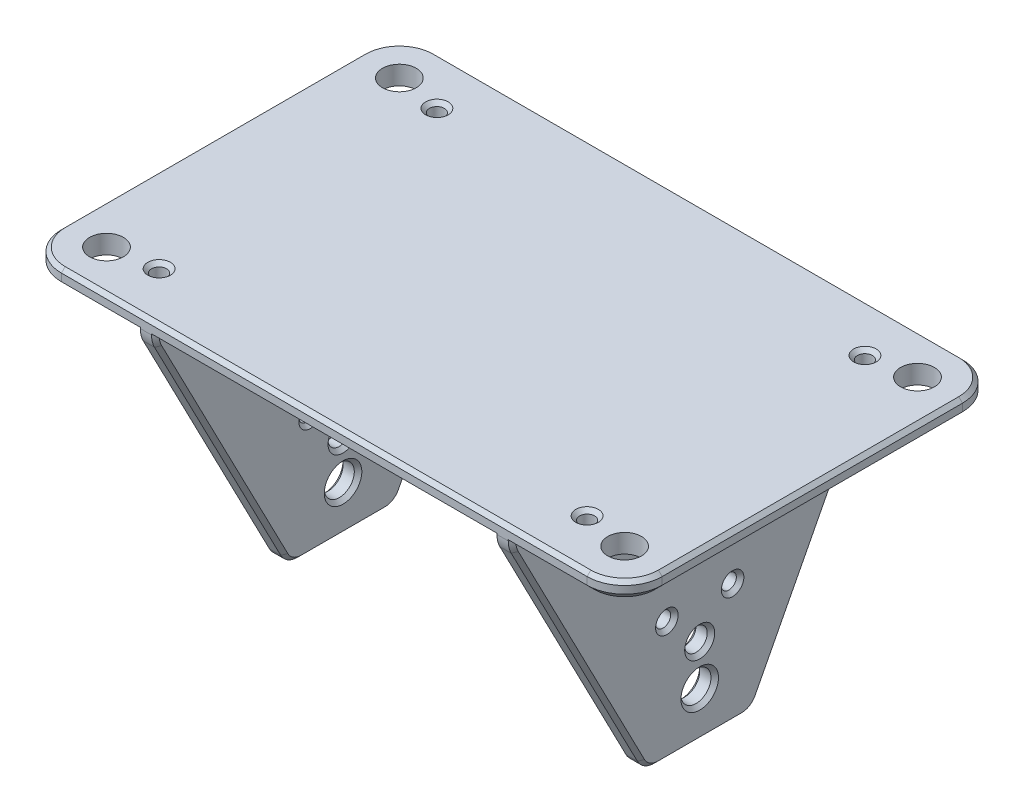
from build123d import *

# Parameters (mm, degrees)
SKETCH1_W           = 160
SKETCH1_H           = 100
BOSS_EXTRUDE1_DEPTH = 5
SKETCH2_R           = 2
CUT_EXTRUDE1_DEPTH  = 95.472218138
SKETCH3_R           = 4.5
CUT_EXTRUDE2_DEPTH  = 95.472218138
BOSS_EXTRUDE2_START = -30
BOSS_EXTRUDE2_DEPTH = 5
SKETCH6_R           = 2
SKETCH6_R_2         = 3
SKETCH6_R_3         = 4
CUT_EXTRUDE3_DEPTH  = 158.721273137
FILLET3_R           = 5
FILLET9_R           = 10
CHAMFER2_SIZE       = 2
FILLET8_R           = 7
CHAMFER3_SIZE       = 1
CHAMFER4_SIZE       = 1
CHAMFER5_SIZE       = 1


with BuildPart() as part:
    # Sketch1 → Boss-Extrude1 (new body)
    with BuildSketch(Plane(origin=(0, 0, 0), x_dir=(1, 0, 0), z_dir=(0, 1, 0))):
        Rectangle(SKETCH1_W, SKETCH1_H)
    extrude(amount=-BOSS_EXTRUDE1_DEPTH)

    # Sketch2 → Cut-Extrude1 (cut, through all)
    with BuildSketch(Plane(origin=(0, 0, 0), x_dir=(1, 0, 0), z_dir=(0, 1, 0))):
        with Locations(Location((-57, 37, 0), (0, 0, 270))):
            Circle(SKETCH2_R)
        with Locations(Location((57, 37, 0), (0, 0, 270))):
            Circle(SKETCH2_R)
        with Locations(Location((57, -37, 0), (0, 0, 270))):
            Circle(SKETCH2_R)
        with Locations(Location((-57, -37, 0), (0, 0, 270))):
            Circle(SKETCH2_R)
    extrude(amount=-CUT_EXTRUDE1_DEPTH, mode=Mode.SUBTRACT)

    # Sketch3 → Cut-Extrude2 (cut, through all)
    with BuildSketch(Plane(origin=(0, 0, 0), x_dir=(1, 0, 0), z_dir=(0, 1, 0))):
        with Locations(Location((-69, 39, 0), (0, 0, 270))):
            Circle(SKETCH3_R)
        with Locations(Location((69, 39, 0), (0, 0, 270))):
            Circle(SKETCH3_R)
        with Locations(Location((-69, -39, 0), (0, 0, 270))):
            Circle(SKETCH3_R)
        with Locations(Location((69, -39, 0), (0, 0, 270))):
            Circle(SKETCH3_R)
    extrude(amount=-CUT_EXTRUDE2_DEPTH, mode=Mode.SUBTRACT)

    # Sketch4 → Boss-Extrude2 (add)
    with BuildSketch(Plane.ZY.offset(80).offset(BOSS_EXTRUDE2_START)):
        Polygon((50, -5), (14.2, -74), (-14.2, -74), (-50, -5), align=None)
    boss_extrude2 = extrude(amount=-BOSS_EXTRUDE2_DEPTH)

    # Mirror1: Boss-Extrude2 across plane
    add(boss_extrude2.mirror(Plane.ZY))

    # Sketch6 → Cut-Extrude3 (cut, through all)
    with BuildSketch(Plane.ZY.offset(50)):
        with Locations(Location((-8.75, -42, 0), (0, 0, 180))):
            Circle(SKETCH6_R)
        with Locations(Location((0, -51, 0), (0, 0, 180))):
            Circle(SKETCH6_R_2)
        with Locations(Location((0, -61.8, 0), (0, 0, 180))):
            Circle(SKETCH6_R_3)
        with Locations(Location((8.75, -42, 0), (0, 0, 180))):
            Circle(SKETCH6_R)
    extrude(amount=-CUT_EXTRUDE3_DEPTH, mode=Mode.SUBTRACT)

    # Fillet3
    fillet3_edges = [part.edges().sort_by_distance(p)[0] for p in [
        (-47.5, -74, 14.2),
        (-47.5, -74, -14.2),
        (47.5, -74, 14.2),
        (47.5, -74, -14.2),
    ]]
    fillet(fillet3_edges, radius=FILLET3_R)

    # Fillet9
    fillet9_edges = [part.edges().sort_by_distance(p)[0] for p in [
        (80, -2.5, 50),
        (-80, -2.5, 50),
        (-80, -2.5, -50),
        (80, -2.5, -50),
    ]]
    fillet(fillet9_edges, radius=FILLET9_R)

    # Chamfer2
    # the kernel refuses this chamfer: 2 mm, written as the material it takes off along each edge
    with BuildSketch(Plane(origin=(-70, -5, 50), x_dir=(0, 0.9996219169112968, 0.02749587661058563), z_dir=(1, 0, 0)), Plane(origin=(50, -5, 50), x_dir=(0, 0.9996219169112968, 0.02749587661058563), z_dir=(1, 0, 0))) as chamfer2_piece_1:
        Polygon((CHAMFER2_SIZE * 0.999621916911, -CHAMFER2_SIZE * 0.0274958766106), (-CHAMFER2_SIZE * 0.0274958766106, -CHAMFER2_SIZE * 0.999621916911), (0, 0), align=None)
    extrude(amount=20, mode=Mode.SUBTRACT)
    with BuildSketch(Plane(origin=(80, -5, 40), x_dir=(-0.9996219169112968, -0.027495876610586414, 0), z_dir=(0, 0, -1)), Plane(origin=(-80, -5, -40), x_dir=(0.9996219169112968, -0.027495876610586414, 0), z_dir=(0, 0, 1))) as chamfer2_piece_2:
        Polygon((CHAMFER2_SIZE * 0.999621916911, CHAMFER2_SIZE * 0.0274958766106), (-CHAMFER2_SIZE * 0.0274958766106, CHAMFER2_SIZE * 0.999621916911), (0, 0), align=None)
    extrude(amount=80, mode=Mode.SUBTRACT)
    with BuildSketch(Plane(origin=(70, -5, -50), x_dir=(0, -0.02749587661058651, 0.9996219169112968), z_dir=(-1, 0, 0)), Plane(origin=(-50, -5, -50), x_dir=(0, -0.02749587661058651, 0.9996219169112968), z_dir=(-1, 0, 0))) as chamfer2_piece_3:
        Polygon((CHAMFER2_SIZE * 0.999621916911, CHAMFER2_SIZE * 0.0274958766106), (-CHAMFER2_SIZE * 0.0274958766106, CHAMFER2_SIZE * 0.999621916911), (0, 0), align=None)
    extrude(amount=20, mode=Mode.SUBTRACT)
    with BuildSketch(Plane(origin=(70, -5, -40), x_dir=(1, 0, 0), z_dir=(0, 0, 1))) as chamfer2_piece_4:
        Polygon((10 - CHAMFER2_SIZE, 0), (10, CHAMFER2_SIZE), (10, 0), align=None)
    revolve(axis=Axis((70, -5, -40), (0, 1, 0)), revolution_arc=90, mode=Mode.SUBTRACT)
    with BuildSketch(Plane(origin=(70, -5, 40), x_dir=(0, 0, 1), z_dir=(-1, 0, 0))) as chamfer2_piece_5:
        Polygon((10, CHAMFER2_SIZE), (10 - CHAMFER2_SIZE, 0), (10, 0), align=None)
    revolve(axis=Axis((70, -5, 40), (0, 1, 0)), revolution_arc=90, mode=Mode.SUBTRACT)
    with BuildSketch(Plane(origin=(-70, -5, 40), x_dir=(0, 0, 1), z_dir=(1, 0, 0))) as chamfer2_piece_6:
        Polygon((10, -CHAMFER2_SIZE), (10 - CHAMFER2_SIZE, 0), (10, 0), align=None)
    revolve(axis=Axis((-70, -5, 40), (0, -1, 0)), revolution_arc=90, mode=Mode.SUBTRACT)
    with BuildSketch(Plane(origin=(-70, -5, -40), x_dir=(-1, 0, 0), z_dir=(0, 0, 1))) as chamfer2_piece_7:
        Polygon((10 - CHAMFER2_SIZE, 0), (10, -CHAMFER2_SIZE), (10, 0), align=None)
    revolve(axis=Axis((-70, -5, -40), (0, -1, 0)), revolution_arc=90, mode=Mode.SUBTRACT)
    with BuildSketch(Plane(origin=(-45, -5, 50), x_dir=(0, 0.9996219169112968, 0.02749587661058563), z_dir=(1, 0, 0))) as chamfer2_piece_8:
        Polygon((CHAMFER2_SIZE * 0.999621916911, -CHAMFER2_SIZE * 0.0274958766106), (-CHAMFER2_SIZE * 0.0274958766106, -CHAMFER2_SIZE * 0.999621916911), (0, 0), align=None)
    extrude(amount=90, mode=Mode.SUBTRACT)
    with BuildSketch(Plane(origin=(45, -5, -50), x_dir=(0, -0.02749587661058651, 0.9996219169112968), z_dir=(-1, 0, 0))) as chamfer2_piece_9:
        Polygon((CHAMFER2_SIZE * 0.999621916911, CHAMFER2_SIZE * 0.0274958766106), (-CHAMFER2_SIZE * 0.0274958766106, CHAMFER2_SIZE * 0.999621916911), (0, 0), align=None)
    extrude(amount=90, mode=Mode.SUBTRACT)

    # Fillet8
    fillet8_edges = [part.edges().sort_by_distance(p)[0] for p in [
        (-47.5, -5, 50),
        (-47.5, -5, -50),
        (47.5, -5, 50),
        (47.5, -5, -50),
    ]]
    fillet(fillet8_edges, radius=FILLET8_R)

    # Chamfer3
    # the kernel refuses this chamfer: 1 mm, written as the material it takes off along each edge
    with BuildSketch(Plane(origin=(-45, -42, 8.75), x_dir=(0, 0, -1), z_dir=(0, 1, 0))) as chamfer3_piece_1:
        Polygon((2 + CHAMFER3_SIZE, 0), (2, CHAMFER3_SIZE), (2, 0), align=None)
    revolve(axis=Axis((-45, -42, 8.75), (-1, 0, 0)), mode=Mode.SUBTRACT)
    with BuildSketch(Plane(origin=(45, -42, 8.75), x_dir=(0, 0, -1), z_dir=(0, 1, 0))) as chamfer3_piece_2:
        Polygon((2 + CHAMFER3_SIZE, 0), (2, -CHAMFER3_SIZE), (2, 0), align=None)
    revolve(axis=Axis((45, -42, 8.75), (-1, 0, 0)), mode=Mode.SUBTRACT)
    with BuildSketch(Plane(origin=(50, -42, 8.75), x_dir=(0, 0, -1), z_dir=(0, 1, 0))) as chamfer3_piece_3:
        Polygon((2 + CHAMFER3_SIZE, 0), (2, CHAMFER3_SIZE), (2, 0), align=None)
    revolve(axis=Axis((50, -42, 8.75), (-1, 0, 0)), mode=Mode.SUBTRACT)
    with BuildSketch(Plane(origin=(-50, -42, 8.75), x_dir=(0, 0, -1), z_dir=(0, 1, 0))) as chamfer3_piece_4:
        Polygon((2 + CHAMFER3_SIZE, 0), (2, -CHAMFER3_SIZE), (2, 0), align=None)
    revolve(axis=Axis((-50, -42, 8.75), (-1, 0, 0)), mode=Mode.SUBTRACT)
    with BuildSketch(Plane(origin=(-50, -71.302712245, -15.599462343), x_dir=(-0.02749587661057553, 0.4603683256604402, 0.8873020801835296), z_dir=(0, 0.8876376809796036, -0.46054244897202645)), Plane(origin=(45, -71.302712245, -15.599462343), x_dir=(-0.027495876610603133, 0.46036832566043984, 0.8873020801835289), z_dir=(0, 0.8876376809796036, -0.46054244897202645)), Plane(origin=(45, -6.515949723, 49.213463767), x_dir=(-0.027495876610602956, 0.46036832566043956, -0.8873020801835292), z_dir=(0, -0.8876376809796038, -0.4605424489720261)), Plane(origin=(-50, -6.515949723, 49.213463767), x_dir=(-0.027495876610575346, 0.46036832566043984, -0.8873020801835297), z_dir=(0, -0.8876376809796038, -0.4605424489720261))) as chamfer3_piece_5:
        Polygon((CHAMFER3_SIZE * 0.999621916911, CHAMFER3_SIZE * 0.0274958766106), (-CHAMFER3_SIZE * 0.0274958766106, CHAMFER3_SIZE * 0.999621916911), (0, 0), align=None)
    extrude(amount=72.987846179, mode=Mode.SUBTRACT)
    with BuildSketch(Plane(origin=(-45, -71.302712245, -15.599462343), x_dir=(0.027495876610603133, 0.46036832566043984, 0.8873020801835289), z_dir=(0, 0.8876376809796036, -0.46054244897202645)), Plane(origin=(50, -71.302712245, -15.599462343), x_dir=(0.02749587661057553, 0.4603683256604402, 0.8873020801835296), z_dir=(0, 0.8876376809796036, -0.46054244897202645)), Plane(origin=(50, -6.515949723, 49.213463767), x_dir=(0.027495876610575346, 0.46036832566043984, -0.8873020801835297), z_dir=(0, -0.8876376809796038, -0.4605424489720261)), Plane(origin=(-45, -6.515949723, 49.213463767), x_dir=(0.027495876610602956, 0.46036832566043956, -0.8873020801835292), z_dir=(0, -0.8876376809796038, -0.4605424489720261))) as chamfer3_piece_6:
        Polygon((CHAMFER3_SIZE * 0.999621916911, -CHAMFER3_SIZE * 0.0274958766106), (-CHAMFER3_SIZE * 0.0274958766106, -CHAMFER3_SIZE * 0.999621916911), (0, 0), align=None)
    extrude(amount=72.987846179, mode=Mode.SUBTRACT)
    with BuildSketch(Plane(origin=(-50, -74, 11.161273938), x_dir=(-0.027495876610575388, 0.999621916911297, 0), z_dir=(0, 0, -1)), Plane(origin=(45, -74, 11.161273938), x_dir=(-0.027495876610602998, 0.9996219169112963, 0), z_dir=(0, 0, -1))) as chamfer3_piece_7:
        Polygon((CHAMFER3_SIZE * 0.999621916911, CHAMFER3_SIZE * 0.0274958766106), (-CHAMFER3_SIZE * 0.0274958766106, CHAMFER3_SIZE * 0.999621916911), (0, 0), align=None)
    extrude(amount=22.322547875, mode=Mode.SUBTRACT)
    with BuildSketch(Plane(origin=(-50, -69, 11.161273938), x_dir=(0, -0.46054244897202634, 0.8876376809796035), z_dir=(0, 0.8876376809796035, 0.46054244897202634))) as chamfer3_piece_8:
        Polygon((5 - CHAMFER3_SIZE, 0), (5, CHAMFER3_SIZE), (5, 0), align=None)
    revolve(axis=Axis((-50, -69, 11.161273938), (1, 0, 0)), revolution_arc=62.577883717, mode=Mode.SUBTRACT)
    with BuildSketch(Plane(origin=(-50, -69, -11.161273938), x_dir=(0, -1, 0), z_dir=(0, 0, 1))) as chamfer3_piece_9:
        Polygon((5 - CHAMFER3_SIZE, 0), (5, CHAMFER3_SIZE), (5, 0), align=None)
    revolve(axis=Axis((-50, -69, -11.161273938), (1, 0, 0)), revolution_arc=62.577883717, mode=Mode.SUBTRACT)
    with BuildSketch(Plane(origin=(-45, -74, 11.161273938), x_dir=(0.027495876610602998, 0.9996219169112963, 0), z_dir=(0, 0, -1)), Plane(origin=(50, -74, 11.161273938), x_dir=(0.027495876610575388, 0.999621916911297, 0), z_dir=(0, 0, -1))) as chamfer3_piece_10:
        Polygon((CHAMFER3_SIZE * 0.999621916911, -CHAMFER3_SIZE * 0.0274958766106), (-CHAMFER3_SIZE * 0.0274958766106, -CHAMFER3_SIZE * 0.999621916911), (0, 0), align=None)
    extrude(amount=22.322547875, mode=Mode.SUBTRACT)
    with BuildSketch(Plane(origin=(-45, -69, 11.161273938), x_dir=(0, -0.46054244897202634, 0.8876376809796035), z_dir=(0, 0.8876376809796035, 0.46054244897202634))) as chamfer3_piece_11:
        Polygon((5 - CHAMFER3_SIZE, 0), (5, -CHAMFER3_SIZE), (5, 0), align=None)
    revolve(axis=Axis((-45, -69, 11.161273938), (1, 0, 0)), revolution_arc=62.577883717, mode=Mode.SUBTRACT)
    with BuildSketch(Plane(origin=(-45, -69, -11.161273938), x_dir=(0, -1, 0), z_dir=(0, 0, 1))) as chamfer3_piece_12:
        Polygon((5 - CHAMFER3_SIZE, 0), (5, -CHAMFER3_SIZE), (5, 0), align=None)
    revolve(axis=Axis((-45, -69, -11.161273938), (1, 0, 0)), revolution_arc=62.577883717, mode=Mode.SUBTRACT)
    with BuildSketch(Plane(origin=(50, -69, 11.161273938), x_dir=(0, -0.46054244897202634, 0.8876376809796035), z_dir=(0, 0.8876376809796035, 0.46054244897202634))) as chamfer3_piece_13:
        Polygon((5 - CHAMFER3_SIZE, 0), (5, -CHAMFER3_SIZE), (5, 0), align=None)
    revolve(axis=Axis((50, -69, 11.161273938), (1, 0, 0)), revolution_arc=62.577883717, mode=Mode.SUBTRACT)
    with BuildSketch(Plane(origin=(50, -69, -11.161273938), x_dir=(0, -1, 0), z_dir=(0, 0, 1))) as chamfer3_piece_14:
        Polygon((5 - CHAMFER3_SIZE, 0), (5, -CHAMFER3_SIZE), (5, 0), align=None)
    revolve(axis=Axis((50, -69, -11.161273938), (1, 0, 0)), revolution_arc=62.577883717, mode=Mode.SUBTRACT)
    with BuildSketch(Plane(origin=(45, -69, 11.161273938), x_dir=(0, -0.46054244897202634, 0.8876376809796035), z_dir=(0, 0.8876376809796035, 0.46054244897202634))) as chamfer3_piece_15:
        Polygon((5 - CHAMFER3_SIZE, 0), (5, CHAMFER3_SIZE), (5, 0), align=None)
    revolve(axis=Axis((45, -69, 11.161273938), (1, 0, 0)), revolution_arc=62.577883717, mode=Mode.SUBTRACT)
    with BuildSketch(Plane(origin=(45, -69, -11.161273938), x_dir=(0, -1, 0), z_dir=(0, 0, 1))) as chamfer3_piece_16:
        Polygon((5 - CHAMFER3_SIZE, 0), (5, CHAMFER3_SIZE), (5, 0), align=None)
    revolve(axis=Axis((45, -69, -11.161273938), (1, 0, 0)), revolution_arc=62.577883717, mode=Mode.SUBTRACT)
    with BuildSketch(Plane(origin=(45, -3.29215258, 50), x_dir=(0.9996219169113155, -1.099413888933916e-14, 0.027495876609905504), z_dir=(0, 1, 0))) as chamfer3_piece_17_section:
        Polygon((CHAMFER3_SIZE * 0.999621916911, CHAMFER3_SIZE * 0.0274958766106), (-CHAMFER3_SIZE * 0.0274958766099, CHAMFER3_SIZE * 0.999621916911), (0, 0), align=None)
    chamfer3_piece_17 = extrude(amount=2.863835568, mode=Mode.PRIVATE)
    chamfer3_piece_17 = split(chamfer3_piece_17, bisect_by=Plane(origin=(45.499119499, -3.038518895, 49.961481105), z_dir=(0, -0.7071067811868302, 0.7071067811862649)), keep=Keep.TOP, mode=Mode.PRIVATE)
    add(chamfer3_piece_17, mode=Mode.SUBTRACT)
    with BuildSketch(Plane(origin=(-50, -3.29215258, 50), x_dir=(0.9996219169113155, -1.099413888933916e-14, 0.027495876609905504), z_dir=(0, 1, 0))) as chamfer3_piece_18_section:
        Polygon((CHAMFER3_SIZE * 0.999621916911, CHAMFER3_SIZE * 0.0274958766106), (-CHAMFER3_SIZE * 0.0274958766099, CHAMFER3_SIZE * 0.999621916911), (0, 0), align=None)
    chamfer3_piece_18 = extrude(amount=2.863835568, mode=Mode.PRIVATE)
    chamfer3_piece_18 = split(chamfer3_piece_18, bisect_by=Plane(origin=(-49.500880501, -3.038518895, 49.961481105), z_dir=(0, -0.7071067811868302, 0.7071067811862649)), keep=Keep.TOP, mode=Mode.PRIVATE)
    add(chamfer3_piece_18, mode=Mode.SUBTRACT)
    with BuildSketch(Plane(origin=(-45, -0.428317012, -50), x_dir=(0.02749587661058938, -3.9969564699715946e-13, 0.9996219169112965), z_dir=(0, -1, 0))) as chamfer3_piece_19_section:
        Polygon((CHAMFER3_SIZE * 0.999621916911, CHAMFER3_SIZE * 0.0274958766106), (-CHAMFER3_SIZE * 0.0274958766106, CHAMFER3_SIZE * 0.999621916911), (0, 0), align=None)
    chamfer3_piece_19 = extrude(amount=2.863835568, mode=Mode.PRIVATE)
    chamfer3_piece_19 = split(chamfer3_piece_19, bisect_by=Plane(origin=(-45.453249928, -3.143706345, -49.856293655), z_dir=(0, -0.7071067811862649, -0.7071067811868302)), keep=Keep.TOP, mode=Mode.PRIVATE)
    add(chamfer3_piece_19, mode=Mode.SUBTRACT)
    with BuildSketch(Plane(origin=(50, -0.428317012, -50), x_dir=(0.02749587661058938, -3.9969564699715946e-13, 0.9996219169112965), z_dir=(0, -1, 0))) as chamfer3_piece_20_section:
        Polygon((CHAMFER3_SIZE * 0.999621916911, CHAMFER3_SIZE * 0.0274958766106), (-CHAMFER3_SIZE * 0.0274958766106, CHAMFER3_SIZE * 0.999621916911), (0, 0), align=None)
    chamfer3_piece_20 = extrude(amount=2.863835568, mode=Mode.PRIVATE)
    chamfer3_piece_20 = split(chamfer3_piece_20, bisect_by=Plane(origin=(49.546750072, -3.143706345, -49.856293655), z_dir=(0, -0.7071067811862649, -0.7071067811868302)), keep=Keep.TOP, mode=Mode.PRIVATE)
    add(chamfer3_piece_20, mode=Mode.SUBTRACT)
    with BuildSketch(Plane(origin=(50, -3.29215258, 50), x_dir=(-0.9996219169113155, -1.0994138889339009e-14, 0.027495876609905122), z_dir=(0, 1, 0))) as chamfer3_piece_21_section:
        Polygon((CHAMFER3_SIZE * 0.999621916911, -CHAMFER3_SIZE * 0.0274958766106), (-CHAMFER3_SIZE * 0.0274958766099, -CHAMFER3_SIZE * 0.999621916911), (0, 0), align=None)
    chamfer3_piece_21 = extrude(amount=2.863835568, mode=Mode.PRIVATE)
    chamfer3_piece_21 = split(chamfer3_piece_21, bisect_by=Plane(origin=(49.500880501, -3.038518895, 49.961481105), z_dir=(0, -0.7071067811868302, 0.7071067811862649)), keep=Keep.TOP, mode=Mode.PRIVATE)
    add(chamfer3_piece_21, mode=Mode.SUBTRACT)
    with BuildSketch(Plane(origin=(-45, -3.29215258, 50), x_dir=(-0.9996219169113155, -1.099413888933916e-14, 0.027495876609905504), z_dir=(0, 1, 0))) as chamfer3_piece_22_section:
        Polygon((CHAMFER3_SIZE * 0.999621916911, -CHAMFER3_SIZE * 0.0274958766106), (-CHAMFER3_SIZE * 0.0274958766099, -CHAMFER3_SIZE * 0.999621916911), (0, 0), align=None)
    chamfer3_piece_22 = extrude(amount=2.863835568, mode=Mode.PRIVATE)
    chamfer3_piece_22 = split(chamfer3_piece_22, bisect_by=Plane(origin=(-45.499119499, -3.038518895, 49.961481105), z_dir=(0, -0.7071067811868302, 0.7071067811862649)), keep=Keep.TOP, mode=Mode.PRIVATE)
    add(chamfer3_piece_22, mode=Mode.SUBTRACT)
    with BuildSketch(Plane(origin=(50, -3.29215258, -43), x_dir=(0, 0, -1), z_dir=(0, 1, 0))) as chamfer3_piece_23_section:
        Polygon((7 - CHAMFER3_SIZE, 0), (7, CHAMFER3_SIZE), (7, 0), align=None)
    chamfer3_piece_23 = revolve(axis=Axis((50, -3.29215258, -43), (-1, 0, 0)), revolution_arc=27.422116283, mode=Mode.PRIVATE)
    chamfer3_piece_23 = split(chamfer3_piece_23, bisect_by=Plane(origin=(49.656075757, -4.244029708, -48.755970292), z_dir=(0, -0.7071067811862649, -0.7071067811868302)), keep=Keep.TOP, mode=Mode.PRIVATE)
    add(chamfer3_piece_23, mode=Mode.SUBTRACT)
    with BuildSketch(Plane(origin=(50, -3.29215258, 43), x_dir=(0, 0, 1), z_dir=(0, 1, 0))) as chamfer3_piece_24_section:
        Polygon((7 - CHAMFER3_SIZE, 0), (7, -CHAMFER3_SIZE), (7, 0), align=None)
    chamfer3_piece_24 = revolve(axis=Axis((50, -3.29215258, 43), (1, 0, 0)), revolution_arc=27.422116283, mode=Mode.PRIVATE)
    chamfer3_piece_24 = split(chamfer3_piece_24, bisect_by=Plane(origin=(49.656075757, -4.244029708, 48.755970292), z_dir=(0, -0.7071067811868302, 0.7071067811862649)), keep=Keep.TOP, mode=Mode.PRIVATE)
    add(chamfer3_piece_24, mode=Mode.SUBTRACT)
    with BuildSketch(Plane(origin=(45, -0.428317012, -50), x_dir=(-0.02749587661058938, -3.9969564699715946e-13, 0.9996219169112965), z_dir=(0, -1, 0))) as chamfer3_piece_25_section:
        Polygon((CHAMFER3_SIZE * 0.999621916911, -CHAMFER3_SIZE * 0.0274958766106), (-CHAMFER3_SIZE * 0.0274958766106, -CHAMFER3_SIZE * 0.999621916911), (0, 0), align=None)
    chamfer3_piece_25 = extrude(amount=2.863835568, mode=Mode.PRIVATE)
    chamfer3_piece_25 = split(chamfer3_piece_25, bisect_by=Plane(origin=(45.453249928, -3.143706345, -49.856293655), z_dir=(0, -0.7071067811862649, -0.7071067811868302)), keep=Keep.TOP, mode=Mode.PRIVATE)
    add(chamfer3_piece_25, mode=Mode.SUBTRACT)
    with BuildSketch(Plane(origin=(45, -3.29215258, -43), x_dir=(0, 0, -1), z_dir=(0, 1, 0))) as chamfer3_piece_26_section:
        Polygon((7 - CHAMFER3_SIZE, 0), (7, -CHAMFER3_SIZE), (7, 0), align=None)
    chamfer3_piece_26 = revolve(axis=Axis((45, -3.29215258, -43), (-1, 0, 0)), revolution_arc=27.422116283, mode=Mode.PRIVATE)
    chamfer3_piece_26 = split(chamfer3_piece_26, bisect_by=Plane(origin=(45.343924243, -4.244029708, -48.755970292), z_dir=(0, -0.7071067811862649, -0.7071067811868302)), keep=Keep.TOP, mode=Mode.PRIVATE)
    add(chamfer3_piece_26, mode=Mode.SUBTRACT)
    with BuildSketch(Plane(origin=(45, -3.29215258, 43), x_dir=(0, 0, 1), z_dir=(0, 1, 0))) as chamfer3_piece_27_section:
        Polygon((7, CHAMFER3_SIZE), (7 - CHAMFER3_SIZE, 0), (7, 0), align=None)
    chamfer3_piece_27 = revolve(axis=Axis((45, -3.29215258, 43), (1, 0, 0)), revolution_arc=27.422116283, mode=Mode.PRIVATE)
    chamfer3_piece_27 = split(chamfer3_piece_27, bisect_by=Plane(origin=(45.343924243, -4.244029708, 48.755970292), z_dir=(0, -0.7071067811868302, 0.7071067811862649)), keep=Keep.TOP, mode=Mode.PRIVATE)
    add(chamfer3_piece_27, mode=Mode.SUBTRACT)
    with BuildSketch(Plane(origin=(-50, -0.428317012, -50), x_dir=(-0.02749587661058938, -3.9969564699715946e-13, 0.9996219169112965), z_dir=(0, -1, 0))) as chamfer3_piece_28_section:
        Polygon((CHAMFER3_SIZE * 0.999621916911, -CHAMFER3_SIZE * 0.0274958766106), (-CHAMFER3_SIZE * 0.0274958766106, -CHAMFER3_SIZE * 0.999621916911), (0, 0), align=None)
    chamfer3_piece_28 = extrude(amount=2.863835568, mode=Mode.PRIVATE)
    chamfer3_piece_28 = split(chamfer3_piece_28, bisect_by=Plane(origin=(-49.546750072, -3.143706345, -49.856293655), z_dir=(0, -0.7071067811862649, -0.7071067811868302)), keep=Keep.TOP, mode=Mode.PRIVATE)
    add(chamfer3_piece_28, mode=Mode.SUBTRACT)
    with BuildSketch(Plane(origin=(-50, -3.29215258, -43), x_dir=(0, 0, -1), z_dir=(0, 1, 0))) as chamfer3_piece_29_section:
        Polygon((7 - CHAMFER3_SIZE, 0), (7, -CHAMFER3_SIZE), (7, 0), align=None)
    chamfer3_piece_29 = revolve(axis=Axis((-50, -3.29215258, -43), (-1, 0, 0)), revolution_arc=27.422116283, mode=Mode.PRIVATE)
    chamfer3_piece_29 = split(chamfer3_piece_29, bisect_by=Plane(origin=(-49.656075757, -4.244029708, -48.755970292), z_dir=(0, -0.7071067811862649, -0.7071067811868302)), keep=Keep.TOP, mode=Mode.PRIVATE)
    add(chamfer3_piece_29, mode=Mode.SUBTRACT)
    with BuildSketch(Plane(origin=(-50, -3.29215258, 43), x_dir=(0, 0, 1), z_dir=(0, 1, 0))) as chamfer3_piece_30_section:
        Polygon((7, CHAMFER3_SIZE), (7 - CHAMFER3_SIZE, 0), (7, 0), align=None)
    chamfer3_piece_30 = revolve(axis=Axis((-50, -3.29215258, 43), (1, 0, 0)), revolution_arc=27.422116283, mode=Mode.PRIVATE)
    chamfer3_piece_30 = split(chamfer3_piece_30, bisect_by=Plane(origin=(-49.656075757, -4.244029708, 48.755970292), z_dir=(0, -0.7071067811868302, 0.7071067811862649)), keep=Keep.TOP, mode=Mode.PRIVATE)
    add(chamfer3_piece_30, mode=Mode.SUBTRACT)
    with BuildSketch(Plane(origin=(-45, -3.29215258, -43), x_dir=(0, 0, -1), z_dir=(0, 1, 0))) as chamfer3_piece_31_section:
        Polygon((7 - CHAMFER3_SIZE, 0), (7, CHAMFER3_SIZE), (7, 0), align=None)
    chamfer3_piece_31 = revolve(axis=Axis((-45, -3.29215258, -43), (-1, 0, 0)), revolution_arc=27.422116283, mode=Mode.PRIVATE)
    chamfer3_piece_31 = split(chamfer3_piece_31, bisect_by=Plane(origin=(-45.343924243, -4.244029708, -48.755970292), z_dir=(0, -0.7071067811862649, -0.7071067811868302)), keep=Keep.TOP, mode=Mode.PRIVATE)
    add(chamfer3_piece_31, mode=Mode.SUBTRACT)
    with BuildSketch(Plane(origin=(-45, -3.29215258, 43), x_dir=(0, 0, 1), z_dir=(0, 1, 0))) as chamfer3_piece_32_section:
        Polygon((7 - CHAMFER3_SIZE, 0), (7, -CHAMFER3_SIZE), (7, 0), align=None)
    chamfer3_piece_32 = revolve(axis=Axis((-45, -3.29215258, 43), (1, 0, 0)), revolution_arc=27.422116283, mode=Mode.PRIVATE)
    chamfer3_piece_32 = split(chamfer3_piece_32, bisect_by=Plane(origin=(-45.343924243, -4.244029708, 48.755970292), z_dir=(0, -0.7071067811868302, 0.7071067811862649)), keep=Keep.TOP, mode=Mode.PRIVATE)
    add(chamfer3_piece_32, mode=Mode.SUBTRACT)
    with BuildSketch(Plane(origin=(-45, -42, -8.75), x_dir=(0, 0, -1), z_dir=(0, 1, 0))) as chamfer3_piece_33:
        Polygon((2 + CHAMFER3_SIZE, 0), (2, CHAMFER3_SIZE), (2, 0), align=None)
    revolve(axis=Axis((-45, -42, -8.75), (-1, 0, 0)), mode=Mode.SUBTRACT)
    with BuildSketch(Plane(origin=(45, -42, -8.75), x_dir=(0, 0, -1), z_dir=(0, 1, 0))) as chamfer3_piece_34:
        Polygon((2 + CHAMFER3_SIZE, 0), (2, -CHAMFER3_SIZE), (2, 0), align=None)
    revolve(axis=Axis((45, -42, -8.75), (-1, 0, 0)), mode=Mode.SUBTRACT)
    with BuildSketch(Plane(origin=(50, -42, -8.75), x_dir=(0, 0, -1), z_dir=(0, 1, 0))) as chamfer3_piece_35:
        Polygon((2 + CHAMFER3_SIZE, 0), (2, CHAMFER3_SIZE), (2, 0), align=None)
    revolve(axis=Axis((50, -42, -8.75), (-1, 0, 0)), mode=Mode.SUBTRACT)
    with BuildSketch(Plane(origin=(-50, -42, -8.75), x_dir=(0, 0, -1), z_dir=(0, 1, 0))) as chamfer3_piece_36:
        Polygon((2 + CHAMFER3_SIZE, 0), (2, -CHAMFER3_SIZE), (2, 0), align=None)
    revolve(axis=Axis((-50, -42, -8.75), (-1, 0, 0)), mode=Mode.SUBTRACT)
    with BuildSketch(Plane(origin=(-45, -51, 0), x_dir=(0, 0, -1), z_dir=(0, 1, 0))) as chamfer3_piece_37:
        Polygon((3 + CHAMFER3_SIZE, 0), (3, CHAMFER3_SIZE), (3, 0), align=None)
    revolve(axis=Axis((-45, -51, 0), (-1, 0, 0)), mode=Mode.SUBTRACT)
    with BuildSketch(Plane(origin=(45, -51, 0), x_dir=(0, 0, -1), z_dir=(0, 1, 0))) as chamfer3_piece_38:
        Polygon((3 + CHAMFER3_SIZE, 0), (3, -CHAMFER3_SIZE), (3, 0), align=None)
    revolve(axis=Axis((45, -51, 0), (-1, 0, 0)), mode=Mode.SUBTRACT)
    with BuildSketch(Plane(origin=(50, -51, 0), x_dir=(0, 0, -1), z_dir=(0, 1, 0))) as chamfer3_piece_39:
        Polygon((3 + CHAMFER3_SIZE, 0), (3, CHAMFER3_SIZE), (3, 0), align=None)
    revolve(axis=Axis((50, -51, 0), (-1, 0, 0)), mode=Mode.SUBTRACT)
    with BuildSketch(Plane(origin=(-50, -51, 0), x_dir=(0, 0, -1), z_dir=(0, 1, 0))) as chamfer3_piece_40:
        Polygon((3 + CHAMFER3_SIZE, 0), (3, -CHAMFER3_SIZE), (3, 0), align=None)
    revolve(axis=Axis((-50, -51, 0), (-1, 0, 0)), mode=Mode.SUBTRACT)
    with BuildSketch(Plane(origin=(-45, -61.8, 0), x_dir=(0, 0, -1), z_dir=(0, 1, 0))) as chamfer3_piece_41:
        Polygon((4 + CHAMFER3_SIZE, 0), (4, CHAMFER3_SIZE), (4, 0), align=None)
    revolve(axis=Axis((-45, -61.8, 0), (-1, 0, 0)), mode=Mode.SUBTRACT)
    with BuildSketch(Plane(origin=(45, -61.8, 0), x_dir=(0, 0, -1), z_dir=(0, 1, 0))) as chamfer3_piece_42:
        Polygon((4 + CHAMFER3_SIZE, 0), (4, -CHAMFER3_SIZE), (4, 0), align=None)
    revolve(axis=Axis((45, -61.8, 0), (-1, 0, 0)), mode=Mode.SUBTRACT)
    with BuildSketch(Plane(origin=(50, -61.8, 0), x_dir=(0, 0, -1), z_dir=(0, 1, 0))) as chamfer3_piece_43:
        Polygon((4 + CHAMFER3_SIZE, 0), (4, CHAMFER3_SIZE), (4, 0), align=None)
    revolve(axis=Axis((50, -61.8, 0), (-1, 0, 0)), mode=Mode.SUBTRACT)
    with BuildSketch(Plane(origin=(-50, -61.8, 0), x_dir=(0, 0, -1), z_dir=(0, 1, 0))) as chamfer3_piece_44:
        Polygon((4 + CHAMFER3_SIZE, 0), (4, -CHAMFER3_SIZE), (4, 0), align=None)
    revolve(axis=Axis((-50, -61.8, 0), (-1, 0, 0)), mode=Mode.SUBTRACT)

    # Chamfer4
    chamfer4_edges = [part.edges().sort_by_distance(p)[0] for p in [
        (0, 0, 50),
        (80, 0, 0),
        (0, 0, -50),
        (-80, 0, 0),
        (-77.071067812, 0, 47.071067812),
        (-77.071067812, 0, -47.071067812),
        (77.071067812, 0, -47.071067812),
        (77.071067812, 0, 47.071067812),
    ]]
    chamfer(chamfer4_edges, length=CHAMFER4_SIZE)

    # Chamfer5
    chamfer5_edges = [part.edges().sort_by_distance(p)[0] for p in [
        (-57, -5, 35),
        (-57, 0, 35),
        (57, -5, 35),
        (57, 0, 35),
        (57, -5, -39),
        (57, 0, -39),
        (-57, -5, -39),
        (-57, 0, -39),
    ]]
    chamfer(chamfer5_edges, length=CHAMFER5_SIZE)


solid = part.part
